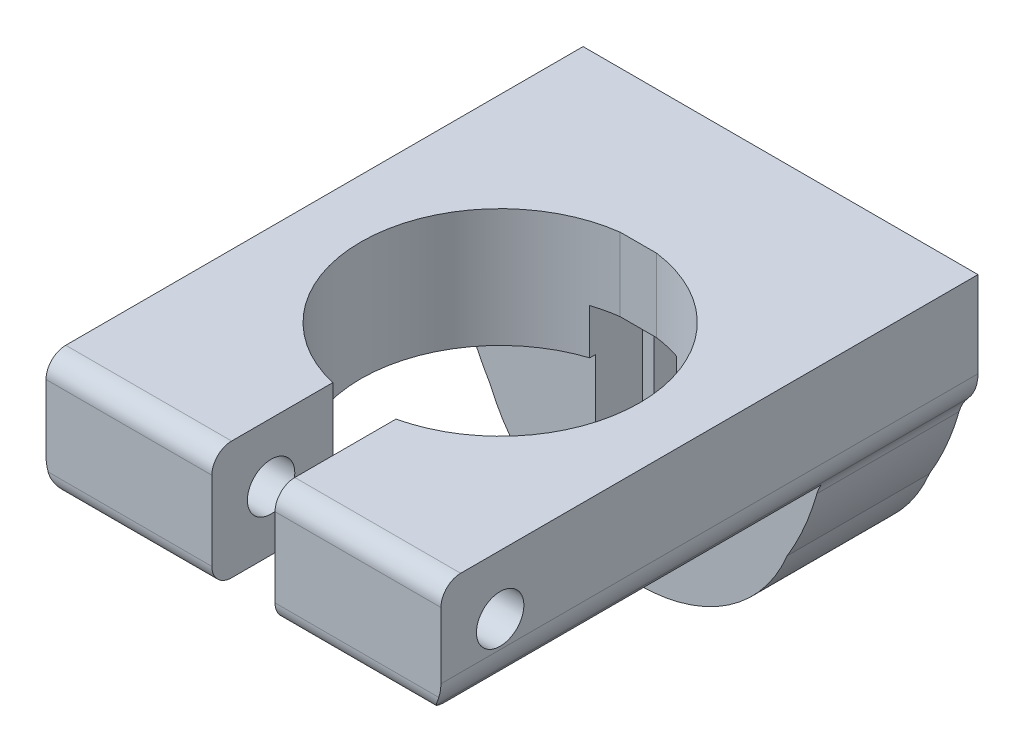
from build123d import *

# Parameters (mm, degrees)
SKETCH1_W               = 55
SKETCH1_H               = 40
BOSS_EXTRUDE1_DEPTH     = 18
SKETCH2_W               = 55
SKETCH2_H               = 15
BOSS_EXTRUDE2_DEPTH     = 50
CUT_EXTRUDE1_START      = -15
CUT_EXTRUDE1_DEPTH      = 15
SKETCH4_W               = 8
SKETCH4_H               = 40.233753348
CUT_EXTRUDE2_DEPTH      = 50
SKETCH6_R               = 3
CUT_EXTRUDE3_DEPTH      = 62
SKETCH7_W               = 8
SKETCH7_H               = 20
CUT_EXTRUDE4_DEPTH      = 18
CUT_EXTRUDE5_DEPTH      = 6
CUT_EXTRUDE5_DEPTH_BACK = 6
SKETCH8_W               = 11
SKETCH8_H               = 21.417406175
FILLET1_R               = 2.5
CUT_EXTRUDE6_DEPTH      = 67.335088131
CUT_EXTRUDE6_DEPTH_BACK = 67.335088131
CUT_EXTRUDE7_DEPTH      = 61
CUT_EXTRUDE8_DEPTH      = 39
FILLET2_R               = 20
CUT_EXTRUDE9_DEPTH      = 80.705724129
CUT_EXTRUDE9_DEPTH_BACK = 80.705724129
FILLET4_DEPTH           = 68
FILLET4_2_DEPTH         = 18
FILLET4_START           = -18
FILLET4_3_DEPTH         = 52
FILLET5_R               = 5


with BuildPart() as part:
    # Sketch1 → Boss-Extrude1 (new body)
    with BuildSketch(Plane.XY):
        with Locations((8.018292683, -5.274390244)):
            Rectangle(SKETCH1_W, SKETCH1_H)
    extrude(amount=BOSS_EXTRUDE1_DEPTH)

    # Sketch2 → Boss-Extrude2 (add)
    with BuildSketch(Plane.XY.offset(18)):
        with Locations((8.018292683, 7.225609756)):
            Rectangle(SKETCH2_W, SKETCH2_H)
    extrude(amount=BOSS_EXTRUDE2_DEPTH)

    # Cut-Extrude1: read off the stored shape, not the designer's step
    # Cut-Extrude1 outline → Cut-Extrude1 (cut)
    with BuildSketch(Plane(origin=(0, -0.274390244, 0), x_dir=(-1, 0, 0), z_dir=(0, -1, 0)).offset(CUT_EXTRUDE1_START)):
        with BuildLine():
            ThreePointArc((-10.314485184, -18), (-8.018292683, -53.15), (-5.722100182, -18))
            Line((-5.722100182, -18), (-10.314485184, -18))
        make_face()
    extrude(amount=CUT_EXTRUDE1_DEPTH, mode=Mode.SUBTRACT)

    # Sketch4 → Cut-Extrude2 (cut)
    with BuildSketch(Plane(origin=(0, -0.274390244, 0), x_dir=(-1, 0, 0), z_dir=(0, -1, 0))):
        with Locations((-8.018292683, -53.15)):
            Rectangle(SKETCH4_W, SKETCH4_H)
    extrude(amount=-CUT_EXTRUDE2_DEPTH, mode=Mode.SUBTRACT)

    # Sketch6 → Cut-Extrude3 (cut)
    with BuildSketch(Plane.ZY.offset(19.481707317)):
        with Locations(Location((60.5, 7.225609756, 0), (0, 0, 270))):
            Circle(SKETCH6_R)
    extrude(amount=-CUT_EXTRUDE3_DEPTH, mode=Mode.SUBTRACT)

    # Sketch7 → Cut-Extrude4 (cut)
    with BuildSketch(Plane(origin=(0, 0, 0), x_dir=(-1, 0, 0), z_dir=(0, 0, -1))):
        with Locations((-8.018292683, -5.274390244)):
            Rectangle(SKETCH7_W, SKETCH7_H)
    extrude(amount=-CUT_EXTRUDE4_DEPTH, mode=Mode.SUBTRACT)

    # Sketch8 → Cut-Extrude5 (cut, two sides: drawn at the far end of the back side and taken through both)
    with BuildSketch(Plane.XY.offset(18).offset(-CUT_EXTRUDE5_DEPTH_BACK)):
        with Locations((8.071503624, -5.248749455)):
            Rectangle(SKETCH8_W, SKETCH8_H)
    extrude(amount=CUT_EXTRUDE5_DEPTH + CUT_EXTRUDE5_DEPTH_BACK, mode=Mode.SUBTRACT)

    # Fillet1
    fillet1_edges = [part.edges().sort_by_distance(p)[0] for p in [
        (35.518292683, -12.774390244, 18),
        (-19.481707317, -12.774390244, 18),
        (-19.481707317, -0.274390244, 43),
        (35.518292683, -0.274390244, 43),
        (-7.731707317, -0.274390244, 68),
        (23.768292683, 14.725609756, 68),
        (8.018292683, -25.274390244, 18),
        (23.768292683, -0.274390244, 68),
        (-7.731707317, 14.725609756, 68),
        (-19.481707317, 14.725609756, 34),
        (35.518292683, 14.725609756, 34),
    ]]
    fillet(fillet1_edges, radius=FILLET1_R)

    # Sketch10 → Cut-Extrude6 (cut, two sides: drawn at the far end of the back side and taken through both)
    with BuildSketch(Plane.XY.offset(18).offset(-CUT_EXTRUDE6_DEPTH_BACK)):
        with BuildLine():
            ThreePointArc((-3.438146554, -22.774390244), (-11.4271438, -17.219826727), (-16.981707317, -9.230829481))
            Line((-16.981707317, -9.230829481), (-16.981707317, -22.774390244))
            Line((-16.981707317, -22.774390244), (-3.438146554, -22.774390244))
        make_face()
        with BuildLine():
            ThreePointArc((-16.981707317, -9.230829481), (-18.849438892, -3.637409944), (-19.481707317, 2.225609756))
            Line((-19.481707317, 2.225609756), (-19.481707317, -25.274390244))
            Line((-19.481707317, -25.274390244), (8.018292683, -25.274390244))
            ThreePointArc((8.018292683, -25.274390244), (2.155272983, -24.642121819), (-3.438146554, -22.774390244))
            Line((-3.438146554, -22.774390244), (-16.981707317, -22.774390244))
            Line((-16.981707317, -22.774390244), (-16.981707317, -9.230829481))
        make_face()
        with BuildLine():
            ThreePointArc((19.47473192, -22.774390244), (13.881312383, -24.642121819), (8.018292683, -25.274390244))
            Line((8.018292683, -25.274390244), (35.518292683, -25.274390244))
            Line((35.518292683, -25.274390244), (35.518292683, 2.225609756))
            ThreePointArc((35.518292683, 2.225609756), (34.886024258, -3.637409944), (33.018292683, -9.230829481))
            Line((33.018292683, -9.230829481), (33.018292683, -22.774390244))
            Line((33.018292683, -22.774390244), (19.47473192, -22.774390244))
        make_face()
        with BuildLine():
            ThreePointArc((33.018292683, -9.230829481), (27.463729166, -17.219826727), (19.47473192, -22.774390244))
            Line((19.47473192, -22.774390244), (33.018292683, -22.774390244))
            Line((33.018292683, -22.774390244), (33.018292683, -9.230829481))
        make_face()
    extrude(amount=CUT_EXTRUDE6_DEPTH + CUT_EXTRUDE6_DEPTH_BACK, mode=Mode.SUBTRACT)

    # Sketch11 → Cut-Extrude7 (cut)
    with BuildSketch(Plane(origin=(0, 14.725609756, 0), x_dir=(1, 0, 0), z_dir=(0, 1, 0))):
        Polygon((-16.981707317, -68), (-16.981707317, 0), (-29.965472326, 0), (-29.965472326, -73.975211298), (-16.981707317, -73.975211298), align=None)
    extrude(amount=-CUT_EXTRUDE7_DEPTH, mode=Mode.SUBTRACT)

    # Sketch12 → Cut-Extrude8 (cut)
    with BuildSketch(Plane(origin=(0, 14.725609756, 0), x_dir=(1, 0, 0), z_dir=(0, 1, 0))):
        Polygon((33.018292683, -34), (33.018292683, -69.603278632), (51.263623859, -69.603278632), (51.263623859, -68), (51.263623859, 5.657942166), (48.966322657, 5.657942166), (33.018292683, 5.657942166), align=None)
    extrude(amount=-CUT_EXTRUDE8_DEPTH, mode=Mode.SUBTRACT)

    # Fillet2
    fillet2_edges = [part.edges().sort_by_distance(p)[0] for p in [
        (-16.981707317, -9.230829481, 9),
        (33.018292683, -9.230829481, 9),
    ]]
    fillet(fillet2_edges, radius=FILLET2_R)

    # Sketch13 → Cut-Extrude9 (cut, two sides: drawn at the far end of the back side and taken through both)
    with BuildSketch(Plane(origin=(0, 0, 0), x_dir=(-1, 0, 0), z_dir=(0, 0, -1)).offset(-CUT_EXTRUDE9_DEPTH_BACK)):
        with BuildLine():
            Line((15.409844247, 2.637038383), (21.378631307, -1.925347001))
            Line((21.378631307, -1.925347001), (18.152736662, -25.695120221))
            Line((18.152736662, -25.695120221), (-4.693551269, -34.090790667))
            Line((-4.693551269, -34.090790667), (-38.816552793, -29.459816409))
            Line((-38.816552793, -29.459816409), (-43.750527307, -6.539564186))
            Line((-43.750527307, -6.539564186), (-31.534000974, 2.637038383))
            ThreePointArc((-31.534000974, 2.637038383), (-29.812131381, -4.006457809), (-26.853089861, -10.198787729))
            ThreePointArc((-26.853089861, -10.198787729), (-8.062078363, -22.773516814), (10.728933135, -10.198787729))
            ThreePointArc((10.728933135, -10.198787729), (13.687974655, -4.006457809), (15.409844247, 2.637038383))
        make_face()
    extrude(amount=CUT_EXTRUDE9_DEPTH + CUT_EXTRUDE9_DEPTH_BACK, mode=Mode.SUBTRACT)

    # Fillet4: read off the stored shape, not the designer's step
    # Fillet4 outline → Fillet4 (add)
    with BuildSketch(Plane.XY):
        with BuildLine():
            ThreePointArc((31.153095191, -0.274390244), (31.967368862, 0.746702465), (33.018292683, 1.52209337))
            Line((33.018292683, 1.52209337), (31.534000974, 2.637038383))
            ThreePointArc((31.534000974, 2.637038383), (31.270593615, 1.175225559), (30.946719887, -0.274390244))
            Line((30.946719887, -0.274390244), (31.153095191, -0.274390244))
        make_face()
        with BuildLine():
            ThreePointArc((-16.981707317, 1.435547188), (-15.921170685, 0.70393524), (-15.08279533, -0.274390244))
            Line((-15.08279533, -0.274390244), (-14.82256316, -0.274390244))
            ThreePointArc((-14.82256316, -0.274390244), (-15.146436888, 1.175225559), (-15.409844247, 2.637038383))
            Line((-15.409844247, 2.637038383), (-16.981707317, 1.435547188))
        make_face()
    extrude(amount=FILLET4_DEPTH)

    # Fillet4 2 outline → Fillet4 2 (add)
    with BuildSketch(Plane.XY):
        with BuildLine():
            ThreePointArc((30.624925491, -1.492895434), (30.848374458, -0.866028928), (31.153095191, -0.274390244))
            Line((31.153095191, -0.274390244), (30.946719887, -0.274390244))
            ThreePointArc((30.946719887, -0.274390244), (30.791189941, -0.885060274), (30.624925491, -1.492895434))
        make_face()
        with BuildLine():
            ThreePointArc((-15.08279533, -0.274390244), (-14.721255817, -0.92925432), (-14.461460233, -1.63072708))
            ThreePointArc((-14.461460233, -1.63072708), (-14.648665519, -0.954330135), (-14.82256316, -0.274390244))
            Line((-14.82256316, -0.274390244), (-15.08279533, -0.274390244))
        make_face()
    extrude(amount=FILLET4_2_DEPTH)

    # Fillet4 3 outline → Fillet4 3 (cut)
    with BuildSketch(Plane.YZ.offset(FILLET4_START)):
        with BuildLine():
            Line((-0.274390244, 68), (-0.274390244, 65.5))
            ThreePointArc((-0.274390244, 65.5), (0.457842803, 67.267766953), (2.225609756, 68))
            Line((2.225609756, 68), (-0.274390244, 68))
        make_face()
    extrude(amount=FILLET4_3_DEPTH, mode=Mode.SUBTRACT)

    # Fillet5
    # the kernel refuses this fillet: 5 mm, written as the material it takes off along each edge
    with BuildSketch(Plane(origin=(33.018292683, 1.52209337, 73.723867582), x_dir=(0, 1, 0), z_dir=(0, 0, -1))) as fillet5_piece_1:
        with BuildLine():
            CenterArc((2.329958397, -5), FILLET5_R, 90, 42.117992045)
            ThreePointArc((-1.023339511, -1.291173616), (-0.45812273, -0.688026327), (0, 0))
            Line((0, 0), (2.329958397, 0))
        make_face()
    extrude(amount=79.548763574, mode=Mode.SUBTRACT)
    with BuildSketch(Plane(origin=(-16.981707317, 1.435547188, -6.007429576), x_dir=(0, 1, 0), z_dir=(0, 0, 1))) as fillet5_piece_2:
        with BuildLine():
            CenterArc((2.40297183, -5), FILLET5_R, 90, 43.236885439)
            ThreePointArc((-1.022109439, -1.357361081), (-0.452973163, -0.72241666), (0, 0))
            Line((0, 0), (2.40297183, 0))
        make_face()
    extrude(amount=79.886736286, mode=Mode.SUBTRACT)


solid = part.part
